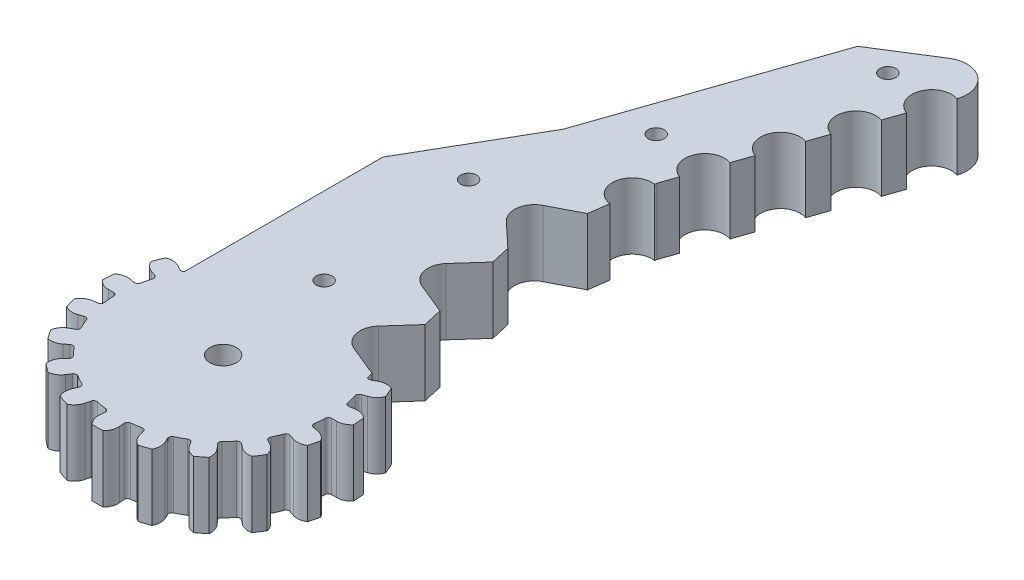
from build123d import *

# Parameters (mm, degrees)
SKETCH1_R           = 16
BOSS_EXTRUDE1_DEPTH = 10
TEETH_DEPTH         = 98.433746164
SPUR_START          = -10
SPUR_TOOTH_DEPTH    = 10
FILLET1_R           = 0.5
SPUR_TEETH_DEPTH    = 10
SKETCH5_R           = 2
CUT_EXTRUDE2_DEPTH  = 98.433746164
SKETCH6_R           = 1.2
CUT_EXTRUDE3_DEPTH  = 98.433746164


# Read off the part's stored shape, not the designer's step: Spur Teeth
with BuildPart() as part:
    # Sketch1 → Boss-Extrude1 (new body)
    with BuildSketch(Plane(origin=(0, 0, 0), x_dir=(1, 0, 0), z_dir=(0, 1, 0))):
        with BuildLine():
            Line((-13.856406461, 38), (-13.856406461, 8))
            ThreePointArc((-13.856406461, 8), (0, 16), (13.856406461, 8))
            Line((13.856406461, 8), (7.538478945, 35.511756749))
            Line((7.538478945, 35.511756749), (10.297712697, 55.320508076))
            Line((10.297712697, 55.320508076), (21.913840197, 89.056191919))
            ThreePointArc((21.913840197, 89.056191919), (20.616236247, 93.493334083), (16, 93.743072959))
            Line((16, 93.743072959), (7.538478945, 88.413658222))
            Line((7.538478945, 88.413658222), (-3.856406461, 55.320508076))
            Line((-3.856406461, 55.320508076), (-13.856406461, 38))
        make_face()
        Circle(SKETCH1_R)
    extrude(amount=BOSS_EXTRUDE1_DEPTH)

    # Sketch2 → Teeth (cut, through all)
    with BuildSketch(Plane(origin=(0, 10, 0), x_dir=(1, 0, 0), z_dir=(0, 1, 0))):
        with BuildLine():
            ThreePointArc((21.913840197, 89.056191919), (18.100580007, 87.196340656), (19.960431271, 83.383080466))
            Line((19.960431271, 83.383080466), (21.913840197, 89.056191919))
        make_face()
        with BuildLine():
            ThreePointArc((18.983726807, 80.546524739), (15.170466617, 78.686673476), (17.030317881, 74.873413285))
            Line((17.030317881, 74.873413285), (18.983726807, 80.546524739))
        make_face()
        with BuildLine():
            ThreePointArc((16.053613417, 72.036857559), (12.240353227, 70.177006295), (14.10020449, 66.363746105))
            Line((14.10020449, 66.363746105), (16.053613417, 72.036857559))
        make_face()
        with BuildLine():
            ThreePointArc((13.123500027, 63.527190378), (9.310239837, 61.667339115), (11.1700911, 57.854078925))
            Line((11.1700911, 57.854078925), (13.123500027, 63.527190378))
        make_face()
        with BuildLine():
            ThreePointArc((10.252673313, 54.997166876), (6.867475551, 52.43973924), (9.424903188, 49.054541478))
            Line((9.424903188, 49.054541478), (10.252673313, 54.997166876))
        make_face()
        with BuildLine():
            Line((3.894063845, 38.934948035), (7.538478945, 35.511756749))
            Line((7.538478945, 35.511756749), (9.011018125, 46.083228779))
            Line((9.011018125, 46.083228779), (4.569828038, 43.786311148))
            ThreePointArc((4.569828038, 43.786311148), (2.976665918, 41.535482158), (3.894063845, 38.934948035))
        make_face()
        with BuildLine():
            Line((10.598081092, 22.18855388), (8.209935159, 32.587864386))
            Line((8.209935159, 32.587864386), (4.875164229, 28.862370748))
            ThreePointArc((4.875164229, 28.862370748), (4.186568048, 26.190051977), (5.972056631, 24.085893514))
            Line((5.972056631, 24.085893514), (10.598081092, 22.18855388))
        make_face()
        with BuildLine():
            Line((13.657683238, 8.86535101), (11.269537305, 19.264661516))
            Line((11.269537305, 19.264661516), (7.934766375, 15.539167879))
            ThreePointArc((7.934766375, 15.539167879), (7.246170194, 12.866849107), (9.031658777, 10.762690644))
            Line((9.031658777, 10.762690644), (13.657683238, 8.86535101))
        make_face()
    extrude(amount=-TEETH_DEPTH, mode=Mode.SUBTRACT)

    # Sketch4 → Spur Tooth (add)
    with BuildSketch(Plane(origin=(0, 10, 0), x_dir=(1, 0, 0), z_dir=(0, 1, 0)).offset(SPUR_START)):
        with BuildLine():
            Line((1.503436562, -17.184358542), (1.394491884, -15.939115169))
            ThreePointArc((1.394491884, -15.939115169), (0, -16), (-1.394491884, -15.939115169))
            Line((-1.394491884, -15.939115169), (-1.503436562, -17.184358542))
            ThreePointArc((-1.503436562, -17.184358542), (-1.370072078, -18.159692258), (-0.82876836, -18.98191621))
            ThreePointArc((-0.82876836, -18.98191621), (0, -19), (0.82876836, -18.98191621))
            ThreePointArc((0.82876836, -18.98191621), (1.370072078, -18.159692258), (1.503436562, -17.184358542))
        make_face()
    extrude(amount=SPUR_TOOTH_DEPTH)

    # Fillet1
    fillet1_edges = [part.edges().sort_by_distance(p)[0] for p in [
        (-1.394491884, 5, 15.939115169),
        (1.394491884, 5, 15.939115169),
    ]]
    fillet(fillet1_edges, radius=FILLET1_R)

    # Spur Teeth outline → Spur Teeth (add)
    with BuildSketch(Plane(origin=(0, 0, 0), x_dir=(1, 0, 0), z_dir=(0, 1, 0))):
        with BuildLine():
            ThreePointArc((4.157775875, -16.74142765), (4.600604643, -17.620611718), (5.379554714, -18.222524279))
            ThreePointArc((5.379554714, -18.222524279), (6.169289915, -17.970527592), (6.947281522, -17.684322985))
            ThreePointArc((6.947281522, -17.684322985), (7.192280231, -16.730888365), (7.00172832, -15.765097543))
            Line((7.00172832, -15.765097543), (6.694229664, -15.072733303))
            ThreePointArc((6.694229664, -15.072733303), (6.681895453, -14.697263483), (6.934486315, -14.419185121))
            ThreePointArc((6.934486315, -14.419185121), (5.195191507, -15.133075867), (3.384162744, -15.638012742))
            ThreePointArc((3.384162744, -15.638012742), (3.754291691, -15.702311123), (3.975176603, -16.006185397))
            Line((3.975176603, -16.006185397), (4.157775875, -16.74142765))
        make_face()
        with BuildLine():
            ThreePointArc((13.856406461, 8), (14.675871013, 6.373288793), (15.305139056, 4.66398097))
            ThreePointArc((15.305139056, 4.66398097), (15.33865282, 5.038155456), (15.623248677, 5.283379673))
            Line((15.623248677, 5.283379673), (16.340900777, 5.5260711))
            ThreePointArc((16.340900777, 5.5260711), (17.180513475, 6.039989828), (17.716045012, 6.865984935))
            ThreePointArc((17.716045012, 6.865984935), (17.399693206, 7.632213068), (17.050220096, 8.383912851))
            ThreePointArc((17.050220096, 8.383912851), (16.079810105, 8.549340758), (15.1330536, 8.279685304))
            Line((15.1330536, 8.279685304), (14.455688749, 7.909081462))
            ThreePointArc((14.455688749, 7.909081462), (14.140699875, 7.853377394), (13.856406461, 8))
        make_face()
        with BuildLine():
            ThreePointArc((15.680277642, 3.182592195), (15.945351889, 1.321269528), (15.990256551, -0.558296911))
            ThreePointArc((15.990256551, -0.558296911), (16.143448704, -0.215278132), (16.492248546, -0.075748964))
            Line((16.492248546, -0.075748964), (17.249818053, -0.079228484))
            ThreePointArc((17.249818053, -0.079228484), (18.210807358, 0.134222913), (18.985522491, 0.741576521))
            ThreePointArc((18.985522491, 0.741576521), (18.935105367, 1.569007564), (18.848644194, 2.393451912))
            ThreePointArc((18.848644194, 2.393451912), (17.984528047, 2.865008088), (17.001512438, 2.917374645))
            Line((17.001512438, 2.917374645), (16.254847902, 2.789250739))
            ThreePointArc((16.254847902, 2.789250739), (15.887839489, 2.869466344), (15.680277642, 3.182592195))
        make_face()
        with BuildLine():
            ThreePointArc((15.864062945, -2.081227256), (15.510404256, -3.927767794), (14.942581635, -5.720074659))
            ThreePointArc((14.942581635, -5.720074659), (15.198851429, -5.445382994), (15.574057381, -5.426669025))
            Line((15.574057381, -5.426669025), (16.289449884, -5.675942431))
            ThreePointArc((16.289449884, -5.675942431), (17.267677693, -5.786089137), (18.197624017, -5.463193216))
            ThreePointArc((18.197624017, -5.463193216), (18.418605053, -4.664224256), (18.604525227, -3.856376679))
            ThreePointArc((18.604525227, -3.856376679), (17.940343316, -3.129792663), (17.027593598, -2.761078824))
            Line((17.027593598, -2.761078824), (16.279783641, -2.639819046))
            ThreePointArc((16.279783641, -2.639819046), (15.958706721, -2.444782306), (15.864062945, -2.081227256))
        make_face()
        with BuildLine():
            ThreePointArc((14.328730872, -7.11951344), (13.394663653, -8.75117053), (12.275646139, -10.261993562))
            ThreePointArc((12.275646139, -10.261993562), (12.607222768, -10.085396115), (12.968175442, -10.189525293))
            Line((12.968175442, -10.189525293), (13.563867063, -10.657579945))
            ThreePointArc((13.563867063, -10.657579945), (14.453327214, -11.079388649), (15.437730616, -11.075941198))
            ThreePointArc((15.437730616, -11.075941198), (15.906163087, -10.392015005), (16.344317272, -9.68830702))
            ThreePointArc((16.344317272, -9.68830702), (15.952044014, -8.785431816), (15.208470781, -8.140326561))
            Line((15.208470781, -8.140326561), (14.540552216, -7.782823475))
            ThreePointArc((14.540552216, -7.782823475), (14.300200454, -7.494100859), (14.328730872, -7.11951344))
        make_face()
        with BuildLine():
            ThreePointArc((11.240658474, -11.386289873), (9.827403403, -12.626248151), (8.278453909, -13.691866231))
            ThreePointArc((8.278453909, -13.691866231), (8.649405898, -13.632500076), (8.956990472, -13.84818839))
            Line((8.956990472, -13.84818839), (9.368428781, -14.484303303))
            ThreePointArc((9.368428781, -14.484303303), (10.072734466, -15.172064487), (11.004919562, -15.48843909))
            ThreePointArc((11.004919562, -15.48843909), (11.670041541, -14.993669679), (12.312948933, -14.470358965))
            ThreePointArc((12.312948933, -14.470358965), (12.235093221, -13.489033111), (11.741274171, -12.637443604))
            Line((11.741274171, -12.637443604), (11.225626339, -12.082438219))
            ThreePointArc((11.225626339, -12.082438219), (11.092045579, -11.731317301), (11.240658474, -11.386289873))
        make_face()
        with BuildLine():
            ThreePointArc((-15.1330536, 8.279685304), (-16.079810105, 8.549340758), (-17.050220096, 8.383912851))
            ThreePointArc((-17.050220096, 8.383912851), (-17.399693206, 7.632213068), (-17.716045012, 6.865984935))
            ThreePointArc((-17.716045012, 6.865984935), (-17.180513475, 6.039989828), (-16.340900777, 5.5260711))
            Line((-16.340900777, 5.5260711), (-15.623248677, 5.283379673))
            ThreePointArc((-15.623248677, 5.283379673), (-15.33865282, 5.038155456), (-15.305139056, 4.66398097))
            ThreePointArc((-15.305139056, 4.66398097), (-14.675871013, 6.373288793), (-13.856406461, 8))
            ThreePointArc((-13.856406461, 8), (-14.140699875, 7.853377394), (-14.455688749, 7.909081462))
            Line((-14.455688749, 7.909081462), (-15.1330536, 8.279685304))
        make_face()
        with BuildLine():
            ThreePointArc((-3.384162744, -15.638012742), (-5.195191507, -15.133075867), (-6.934486315, -14.419185121))
            ThreePointArc((-6.934486315, -14.419185121), (-6.681895453, -14.697263483), (-6.694229664, -15.072733303))
            Line((-6.694229664, -15.072733303), (-7.00172832, -15.765097543))
            ThreePointArc((-7.00172832, -15.765097543), (-7.192280231, -16.730888365), (-6.947281522, -17.684322985))
            ThreePointArc((-6.947281522, -17.684322985), (-6.169289915, -17.970527592), (-5.379554714, -18.222524279))
            ThreePointArc((-5.379554714, -18.222524279), (-4.600604643, -17.620611718), (-4.157775875, -16.74142765))
            Line((-4.157775875, -16.74142765), (-3.975176603, -16.006185397))
            ThreePointArc((-3.975176603, -16.006185397), (-3.754291691, -15.702311123), (-3.384162744, -15.638012742))
        make_face()
        with BuildLine():
            ThreePointArc((-8.278453909, -13.691866231), (-9.827403403, -12.626248151), (-11.240658474, -11.386289873))
            ThreePointArc((-11.240658474, -11.386289873), (-11.092045579, -11.731317301), (-11.225626339, -12.082438219))
            Line((-11.225626339, -12.082438219), (-11.741274171, -12.637443604))
            ThreePointArc((-11.741274171, -12.637443604), (-12.235093221, -13.489033111), (-12.312948933, -14.470358965))
            ThreePointArc((-12.312948933, -14.470358965), (-11.670041541, -14.993669679), (-11.004919562, -15.48843909))
            ThreePointArc((-11.004919562, -15.48843909), (-10.072734466, -15.172064487), (-9.368428781, -14.484303303))
            Line((-9.368428781, -14.484303303), (-8.956990472, -13.84818839))
            ThreePointArc((-8.956990472, -13.84818839), (-8.649405898, -13.632500076), (-8.278453909, -13.691866231))
        make_face()
        with BuildLine():
            ThreePointArc((-12.275646139, -10.261993562), (-13.394663653, -8.75117053), (-14.328730872, -7.11951344))
            ThreePointArc((-14.328730872, -7.11951344), (-14.300200454, -7.494100859), (-14.540552216, -7.782823475))
            Line((-14.540552216, -7.782823475), (-15.208470781, -8.140326561))
            ThreePointArc((-15.208470781, -8.140326561), (-15.952044014, -8.785431816), (-16.344317272, -9.68830702))
            ThreePointArc((-16.344317272, -9.68830702), (-15.906163087, -10.392015005), (-15.437730616, -11.075941198))
            ThreePointArc((-15.437730616, -11.075941198), (-14.453327214, -11.079388649), (-13.563867063, -10.657579945))
            Line((-13.563867063, -10.657579945), (-12.968175442, -10.189525293))
            ThreePointArc((-12.968175442, -10.189525293), (-12.607222768, -10.085396115), (-12.275646139, -10.261993562))
        make_face()
        with BuildLine():
            ThreePointArc((-14.942581635, -5.720074659), (-15.510404256, -3.927767794), (-15.864062945, -2.081227256))
            ThreePointArc((-15.864062945, -2.081227256), (-15.958706721, -2.444782306), (-16.279783641, -2.639819046))
            Line((-16.279783641, -2.639819046), (-17.027593598, -2.761078824))
            ThreePointArc((-17.027593598, -2.761078824), (-17.940343316, -3.129792663), (-18.604525227, -3.856376679))
            ThreePointArc((-18.604525227, -3.856376679), (-18.418605053, -4.664224256), (-18.197624017, -5.463193216))
            ThreePointArc((-18.197624017, -5.463193216), (-17.267677693, -5.786089137), (-16.289449884, -5.675942431))
            Line((-16.289449884, -5.675942431), (-15.574057381, -5.426669025))
            ThreePointArc((-15.574057381, -5.426669025), (-15.198851429, -5.445382994), (-14.942581635, -5.720074659))
        make_face()
        with BuildLine():
            ThreePointArc((-15.990256551, -0.558296911), (-15.945351889, 1.321269528), (-15.680277642, 3.182592195))
            ThreePointArc((-15.680277642, 3.182592195), (-15.887839489, 2.869466344), (-16.254847902, 2.789250739))
            Line((-16.254847902, 2.789250739), (-17.001512438, 2.917374645))
            ThreePointArc((-17.001512438, 2.917374645), (-17.984528047, 2.865008088), (-18.848644194, 2.393451912))
            ThreePointArc((-18.848644194, 2.393451912), (-18.935105367, 1.569007564), (-18.985522491, 0.741576521))
            ThreePointArc((-18.985522491, 0.741576521), (-18.210807358, 0.134222913), (-17.249818053, -0.079228484))
            Line((-17.249818053, -0.079228484), (-16.492248546, -0.075748964))
            ThreePointArc((-16.492248546, -0.075748964), (-16.143448704, -0.215278132), (-15.990256551, -0.558296911))
        make_face()
    extrude(amount=SPUR_TEETH_DEPTH)

    # Sketch5 → Cut-Extrude2 (cut, through all)
    with BuildSketch(Plane(origin=(0, 10, 0), x_dir=(1, 0, 0), z_dir=(0, 1, 0))):
        with Locations(Location((0, 0, 0), (0, 0, 270))):
            Circle(SKETCH5_R)
    extrude(amount=-CUT_EXTRUDE2_DEPTH, mode=Mode.SUBTRACT)

    # Sketch6 → Cut-Extrude3 (cut, through all)
    with BuildSketch(Plane(origin=(0, 10, 0), x_dir=(1, 0, 0), z_dir=(0, 1, 0))):
        with Locations(Location((-2.12712731, 17.401914698, 0), (0, 0, 270))):
            Circle(SKETCH6_R)
        with Locations(Location((-4.419264484, 41.535482158, 0), (0, 0, 270))):
            Circle(SKETCH6_R)
        with Locations(Location((3.81961128, 61.667339115, 0), (0, 0, 270))):
            Circle(SKETCH6_R)
        with Locations(Location((13.319322893, 87.196340656, 0), (0, 0, 270))):
            Circle(SKETCH6_R)
    extrude(amount=-CUT_EXTRUDE3_DEPTH, mode=Mode.SUBTRACT)


solid = part.part
